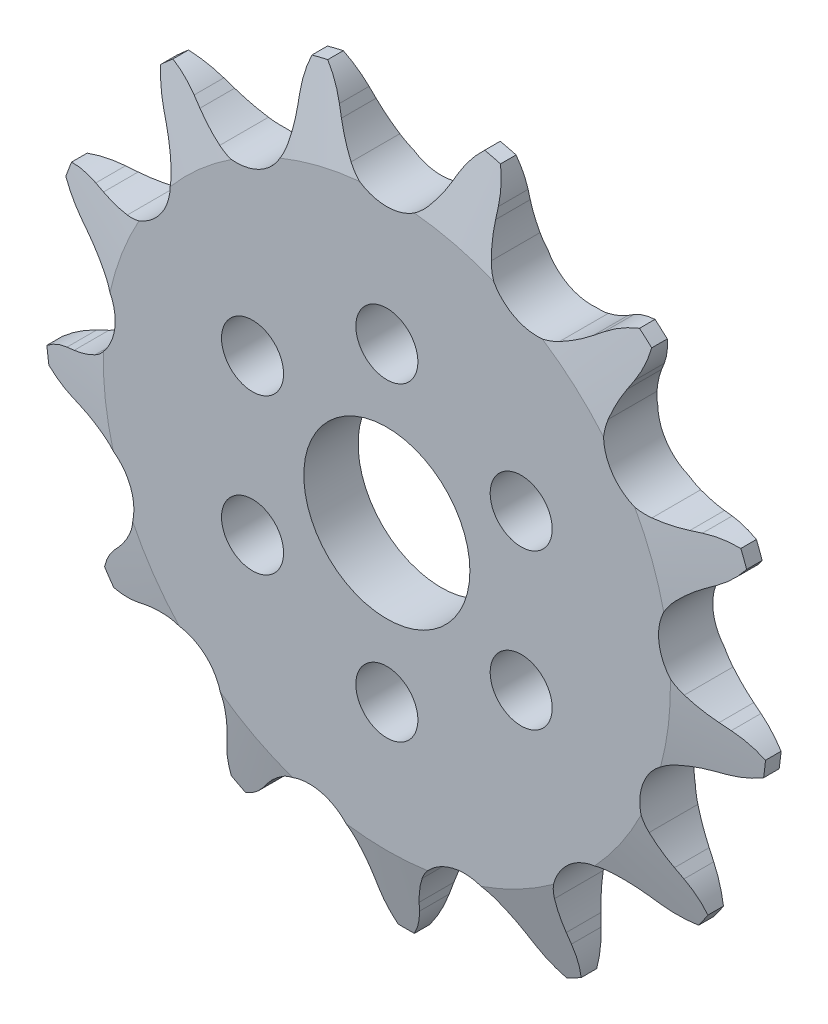
from build123d import *

# Parameters (mm, degrees)
CUT_EXTRUDE1_DEPTH      = 53.351870728
CIRPATTERN1_COUNT       = 13
CUT_EXTRUDE2_DEPTH      = 53.225813528
CUT_EXTRUDE2_DEPTH_BACK = 53.225813528
SKETCH3_OUTSIDE_W       = 96.34
SKETCH3_OUTSIDE_H       = 95.814
SKETCH3_OUTSIDE_R       = 36.957
SKETCH3_OUTSIDE_R_2     = 8.5
SKETCH4_R               = 3.175
CUT_EXTRUDE3_DEPTH      = 53.434548787


with BuildPart() as part:
    # Sketch1 → Revolve1 (revolve)
    with BuildSketch(Plane(origin=(0, 0, 0), x_dir=(0, 0, -1), z_dir=(1, 0, 0))):
        Polygon((2.778125, 0), (-2.778125, 0), (-2.778125, 29.028703417), (-0.79375, 36.966203417), (0.79375, 36.966203417), (2.778125, 29.028703417), align=None)
    revolve(axis=Axis((0, 0, -2.778125), (0, 0, 1)))

    # Sketch0 → Cut-Extrude1 (cut, symmetric)
    with BuildSketch(Plane.XY):
        with BuildLine():
            Line((13.954470356, -31.067878996), (13.281475664, -30.259243053))
            ThreePointArc((13.281475664, -30.259243053), (12.198620666, -29.105809316), (10.985992947, -28.089680215))
            ThreePointArc((10.985992947, -28.089680215), (6.712108073, -27.232092935), (3.326311638, -29.977622096))
            ThreePointArc((3.326311638, -29.977622096), (2.724801857, -31.440895931), (2.302008759, -32.965438593))
            Line((2.302008759, -32.965438593), (2.081893414, -33.99420639))
            ThreePointArc((2.081893414, -33.99420639), (-1.570781615, -39.344985469), (-7.926123198, -40.602962015))
            ThreePointArc((-7.926123198, -40.602962015), (9.900335889, -40.167241661), (25.887370848, -32.268684261))
            ThreePointArc((25.887370848, -32.268684261), (19.675384497, -34.108275848), (13.954470356, -31.067878996))
        make_face()
    cut_extrude1 = extrude(amount=CUT_EXTRUDE1_DEPTH, both=True, mode=Mode.SUBTRACT)

    # CirPattern1: Cut-Extrude1 ×13 about axis
    cirpattern1_axis = Axis((0, 0, -2.778125), (0, 0, -1))
    for i in range(1, CIRPATTERN1_COUNT):
        add(cut_extrude1.rotate(cirpattern1_axis, i * 360 / CIRPATTERN1_COUNT), mode=Mode.SUBTRACT)

    # Sketch3 outside → Cut-Extrude2 (cut, two sides: drawn at the far end of the back side and taken through both)
    # profile 1 of 2: a face of its own
    with BuildSketch(Plane.XY.offset(-CUT_EXTRUDE2_DEPTH_BACK)):
        with Locations((0, -0.442)):
            Rectangle(SKETCH3_OUTSIDE_W, SKETCH3_OUTSIDE_H)
        Circle(SKETCH3_OUTSIDE_R, mode=Mode.SUBTRACT)
    # profile 2 of 2: a face of its own
    with BuildSketch(Plane.XY.offset(-CUT_EXTRUDE2_DEPTH_BACK)):
        Circle(SKETCH3_OUTSIDE_R_2)
    extrude(amount=CUT_EXTRUDE2_DEPTH + CUT_EXTRUDE2_DEPTH_BACK, mode=Mode.SUBTRACT)

    # Sketch4 → Cut-Extrude3 (cut, through all)
    with BuildSketch(Plane(origin=(0, 0, -2.778125), x_dir=(-1, 0, 0), z_dir=(0, 0, -1))):
        with Locations((0, 15.875)):
            Circle(SKETCH4_R)
        with Locations((13.748153285, 7.9375)):
            Circle(SKETCH4_R)
        with Locations((13.748153285, -7.9375)):
            Circle(SKETCH4_R)
        with Locations((0, -15.875)):
            Circle(SKETCH4_R)
        with Locations((-13.748153285, -7.9375)):
            Circle(SKETCH4_R)
        with Locations((-13.748153285, 7.9375)):
            Circle(SKETCH4_R)
    extrude(amount=-CUT_EXTRUDE3_DEPTH, mode=Mode.SUBTRACT)


solid = part.part
